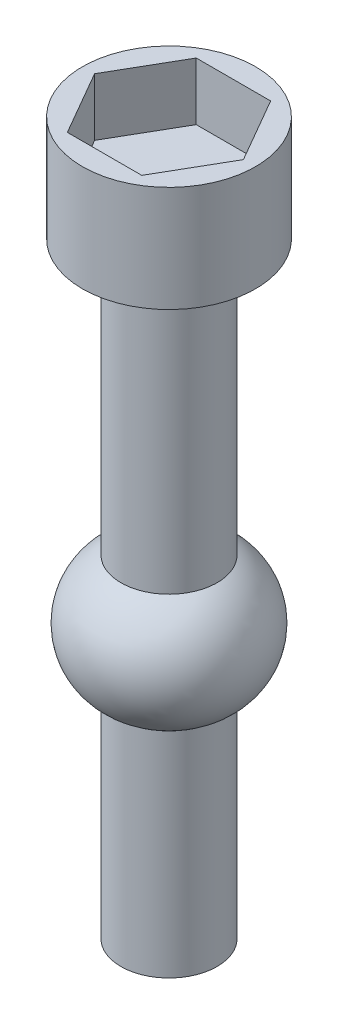
from build123d import *

# Parameters (mm, degrees)
SKETCH1_R           = 1.25
BOSS_EXTRUDE1_DEPTH = 18.5
SKETCH2_R           = 2.25
BOSS_EXTRUDE2_DEPTH = 2.75
CUT_EXTRUDE1_DEPTH  = 1.5


with BuildPart() as part:
    # Sketch1 → Boss-Extrude1 (new body)
    with BuildSketch(Plane(origin=(0, 0, 0), x_dir=(1, 0, 0), z_dir=(0, 1, 0))):
        Circle(SKETCH1_R)
    extrude(amount=BOSS_EXTRUDE1_DEPTH)

    # Sketch2 → Boss-Extrude2 (add)
    with BuildSketch(Plane(origin=(0, 18.5, 0), x_dir=(1, 0, 0), z_dir=(0, 1, 0))):
        Circle(SKETCH2_R)
    extrude(amount=-BOSS_EXTRUDE2_DEPTH)

    # Sketch4 → Revolve1 (revolve)
    with BuildSketch(Plane.XY):
        with BuildLine():
            Line((1.25, 8.636562631), (1.25, 5.576897201))
            ThreePointArc((1.25, 5.576897201), (2.168320153, 7.106729916), (1.25, 8.636562631))
        make_face()
    revolve(axis=Axis((0, 0, 0), (0, 1, 0)))

    # Sketch5 → Cut-Extrude1 (cut)
    with BuildSketch(Plane(origin=(0, 18.5, 0), x_dir=(1, 0, 0), z_dir=(0, 1, 0))):
        Polygon((0.966659902, 1.674304064), (-0.966659902, 1.674304064), (-1.933319804, 0), (-0.966659902, -1.674304064), (0.966659902, -1.674304064), (1.933319804, 0), align=None)
    extrude(amount=-CUT_EXTRUDE1_DEPTH, mode=Mode.SUBTRACT)


solid = part.part
